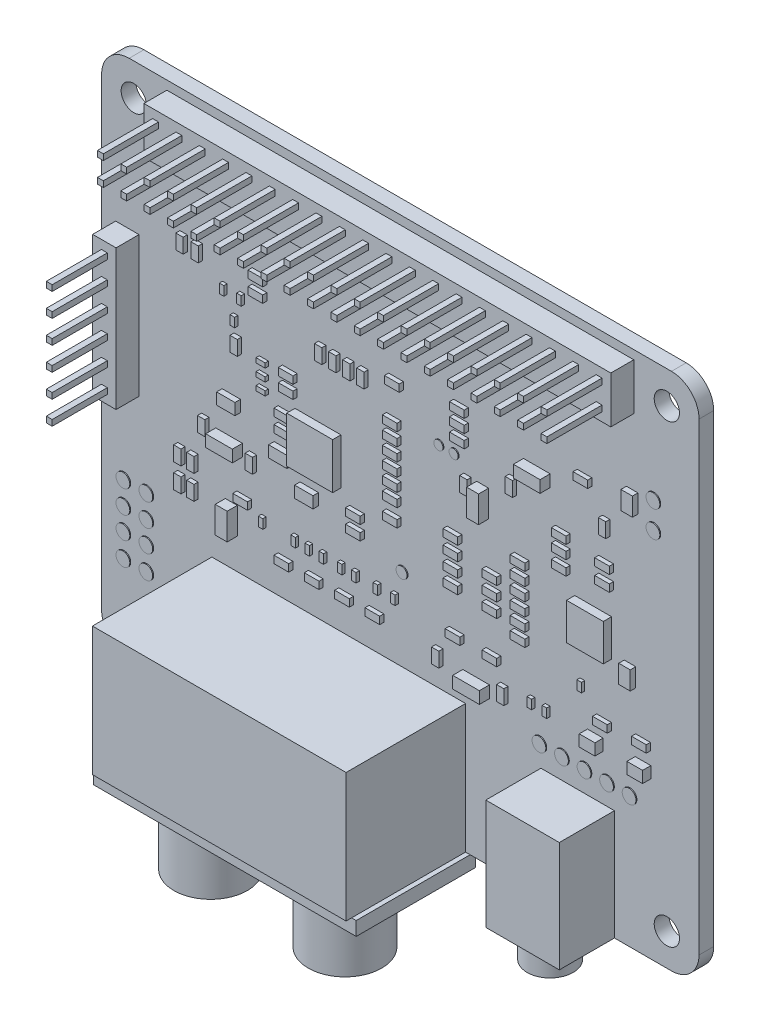
from build123d import *

# Parameters (mm, degrees)
PCB_DEPTH              = 1.6
SKETCH2_W              = 50.8
SKETCH2_H              = 5.08
SKETCH2_W_2            = 2.54
SKETCH2_H_2            = 15.24
HEADER_BLOCKS_DEPTH    = 2.5
SKETCH3_W              = 0.64
SKETCH3_H              = 0.64
HEADER_PINS_DEPTH      = 6
SKETCH4_W              = 1
SKETCH4_H              = 0.5
SKETCH4_W_2            = 0.5
SKETCH4_H_2            = 1
SMD_H0_35_DEPTH        = 0.35
SKETCH5_W              = 0.8
SKETCH5_H              = 1.6
SKETCH5_W_2            = 1.6
SKETCH5_H_2            = 0.8
SMD_H0_45_DEPTH        = 0.45
SKETCH6_W              = 2
SKETCH6_H              = 1.25
SKETCH6_W_2            = 1.25
SKETCH6_H_2            = 2
SMD_H0_6_DEPTH         = 0.6
SKETCH7_W              = 5
SKETCH7_H              = 5
SKETCH7_W_2            = 4
SKETCH7_H_2            = 4
SKETCH7_W_3            = 1.7
SKETCH7_H_3            = 1.25
SMD_H0_9_DEPTH         = 0.9
SKETCH8_W              = 2.9
SKETCH8_H              = 1.3
SKETCH8_W_2            = 1.3
SKETCH8_H_2            = 2.9
SMD_H1_1_DEPTH         = 1.1
SKETCH9_R              = 0.75
SKETCH9_R_2            = 0.6
SKETCH9_R_3            = 0.5
PADS_DEPTH             = 0.1
SKETCH10_W             = 27.6
SKETCH10_H             = 14
RCA_HOUSING_DEPTH      = 13
SKETCH11_W             = 28.6
SKETCH11_H             = 13
RCA_PLATE_DEPTH        = 1.5
SKETCH12_R             = 4
RCA_BARRELS_DEPTH      = 9
SKETCH13_W             = 8
SKETCH13_H             = 12
JACK_BODY_DEPTH        = 6
SKETCH14_R             = 2.5
JACK_NOSE_DEPTH        = 2.5
SKETCH15_R             = 2.5
RCA_BORES_DEPTH        = 9
SKETCH16_R             = 1.75
JACK_BORE_DEPTH        = 2.5
MOUNT_HOLES_DEPTH      = 88.35221806
MOUNT_HOLES_DEPTH_BACK = 88.35221806
SKETCH17_R             = 1.375


with BuildPart() as part:
    # Sketch1 → PCB (new body)
    with BuildSketch(Plane.XY):
        with BuildLine():
            Line((3, 0), (62, 0))
            ThreePointArc((62, 0), (64.121320344, 0.878679656), (65, 3))
            Line((65, 3), (65, 53.5))
            ThreePointArc((65, 53.5), (64.121320344, 55.621320344), (62, 56.5))
            Line((62, 56.5), (3, 56.5))
            ThreePointArc((3, 56.5), (0.878679656, 55.621320344), (0, 53.5))
            Line((0, 53.5), (0, 3))
            ThreePointArc((0, 3), (0.878679656, 0.878679656), (3, 0))
        make_face()
    extrude(amount=PCB_DEPTH)

    # Sketch2 → Header_Blocks (add)
    with BuildSketch(Plane.XY.offset(1.6)):
        with Locations((32.5, 53)):
            Rectangle(SKETCH2_W, SKETCH2_H)
        with Locations((2.8, 32.8)):
            Rectangle(SKETCH2_W_2, SKETCH2_H_2)
    extrude(amount=HEADER_BLOCKS_DEPTH)

    # Sketch3 → Header_Pins (add)
    with BuildSketch(Plane.XY.offset(4.1)):
        with Locations((8.37, 51.73)):
            Rectangle(SKETCH3_W, SKETCH3_H)
        with Locations((8.37, 54.27)):
            Rectangle(SKETCH3_W, SKETCH3_H)
        with Locations((10.91, 51.73)):
            Rectangle(SKETCH3_W, SKETCH3_H)
        with Locations((10.91, 54.27)):
            Rectangle(SKETCH3_W, SKETCH3_H)
        with Locations((13.45, 51.73)):
            Rectangle(SKETCH3_W, SKETCH3_H)
        with Locations((13.45, 54.27)):
            Rectangle(SKETCH3_W, SKETCH3_H)
        with Locations((15.99, 51.73)):
            Rectangle(SKETCH3_W, SKETCH3_H)
        with Locations((15.99, 54.27)):
            Rectangle(SKETCH3_W, SKETCH3_H)
        with Locations((18.53, 51.73)):
            Rectangle(SKETCH3_W, SKETCH3_H)
        with Locations((18.53, 54.27)):
            Rectangle(SKETCH3_W, SKETCH3_H)
        with Locations((21.07, 51.73)):
            Rectangle(SKETCH3_W, SKETCH3_H)
        with Locations((21.07, 54.27)):
            Rectangle(SKETCH3_W, SKETCH3_H)
        with Locations((23.61, 51.73)):
            Rectangle(SKETCH3_W, SKETCH3_H)
        with Locations((23.61, 54.27)):
            Rectangle(SKETCH3_W, SKETCH3_H)
        with Locations((26.15, 51.73)):
            Rectangle(SKETCH3_W, SKETCH3_H)
        with Locations((26.15, 54.27)):
            Rectangle(SKETCH3_W, SKETCH3_H)
        with Locations((28.69, 51.73)):
            Rectangle(SKETCH3_W, SKETCH3_H)
        with Locations((28.69, 54.27)):
            Rectangle(SKETCH3_W, SKETCH3_H)
        with Locations((31.23, 51.73)):
            Rectangle(SKETCH3_W, SKETCH3_H)
        with Locations((31.23, 54.27)):
            Rectangle(SKETCH3_W, SKETCH3_H)
        with Locations((33.77, 51.73)):
            Rectangle(SKETCH3_W, SKETCH3_H)
        with Locations((33.77, 54.27)):
            Rectangle(SKETCH3_W, SKETCH3_H)
        with Locations((36.31, 51.73)):
            Rectangle(SKETCH3_W, SKETCH3_H)
        with Locations((36.31, 54.27)):
            Rectangle(SKETCH3_W, SKETCH3_H)
        with Locations((38.85, 51.73)):
            Rectangle(SKETCH3_W, SKETCH3_H)
        with Locations((38.85, 54.27)):
            Rectangle(SKETCH3_W, SKETCH3_H)
        with Locations((41.39, 51.73)):
            Rectangle(SKETCH3_W, SKETCH3_H)
        with Locations((41.39, 54.27)):
            Rectangle(SKETCH3_W, SKETCH3_H)
        with Locations((43.93, 51.73)):
            Rectangle(SKETCH3_W, SKETCH3_H)
        with Locations((43.93, 54.27)):
            Rectangle(SKETCH3_W, SKETCH3_H)
        with Locations((46.47, 51.73)):
            Rectangle(SKETCH3_W, SKETCH3_H)
        with Locations((46.47, 54.27)):
            Rectangle(SKETCH3_W, SKETCH3_H)
        with Locations((49.01, 51.73)):
            Rectangle(SKETCH3_W, SKETCH3_H)
        with Locations((49.01, 54.27)):
            Rectangle(SKETCH3_W, SKETCH3_H)
        with Locations((51.55, 51.73)):
            Rectangle(SKETCH3_W, SKETCH3_H)
        with Locations((51.55, 54.27)):
            Rectangle(SKETCH3_W, SKETCH3_H)
        with Locations((54.09, 51.73)):
            Rectangle(SKETCH3_W, SKETCH3_H)
        with Locations((54.09, 54.27)):
            Rectangle(SKETCH3_W, SKETCH3_H)
        with Locations((56.63, 51.73)):
            Rectangle(SKETCH3_W, SKETCH3_H)
        with Locations((56.63, 54.27)):
            Rectangle(SKETCH3_W, SKETCH3_H)
        with Locations((2.8, 26.45)):
            Rectangle(SKETCH3_W, SKETCH3_H)
        with Locations((2.8, 28.99)):
            Rectangle(SKETCH3_W, SKETCH3_H)
        with Locations((2.8, 31.53)):
            Rectangle(SKETCH3_W, SKETCH3_H)
        with Locations((2.8, 34.07)):
            Rectangle(SKETCH3_W, SKETCH3_H)
        with Locations((2.8, 36.61)):
            Rectangle(SKETCH3_W, SKETCH3_H)
        with Locations((2.8, 39.15)):
            Rectangle(SKETCH3_W, SKETCH3_H)
    extrude(amount=HEADER_PINS_DEPTH)

    # Sketch4 → SMD_h0_35 (add)
    with BuildSketch(Plane.XY.offset(1.6)):
        with Locations((17.6462, 35.28966)):
            Rectangle(SKETCH4_W, SKETCH4_H)
        with Locations((17.6462, 33.97505)):
            Rectangle(SKETCH4_W, SKETCH4_H)
        with Locations((17.6462, 32.66044)):
            Rectangle(SKETCH4_W, SKETCH4_H)
        with Locations((13.40234, 40.07006)):
            Rectangle(SKETCH4_W_2, SKETCH4_H_2)
        with Locations((15.2885, 40.07006)):
            Rectangle(SKETCH4_W_2, SKETCH4_H_2)
        with Locations((14.58119, 37.67986)):
            Rectangle(SKETCH4_W_2, SKETCH4_H_2)
        with Locations((17.6462, 20.2314)):
            Rectangle(SKETCH4_W_2, SKETCH4_H_2)
        with Locations((21.18275, 20.2314)):
            Rectangle(SKETCH4_W_2, SKETCH4_H_2)
        with Locations((22.715255, 20.2314)):
            Rectangle(SKETCH4_W_2, SKETCH4_H_2)
        with Locations((24.24776, 20.2314)):
            Rectangle(SKETCH4_W_2, SKETCH4_H_2)
        with Locations((26.251805, 20.2314)):
            Rectangle(SKETCH4_W_2, SKETCH4_H_2)
        with Locations((27.78431, 20.2314)):
            Rectangle(SKETCH4_W_2, SKETCH4_H_2)
        with Locations((30.14201, 20.2314)):
            Rectangle(SKETCH4_W_2, SKETCH4_H_2)
        with Locations((32.02817, 20.2314)):
            Rectangle(SKETCH4_W_2, SKETCH4_H_2)
        with Locations((46.88168, 17.8412)):
            Rectangle(SKETCH4_W_2, SKETCH4_H_2)
        with Locations((48.53207, 17.8412)):
            Rectangle(SKETCH4_W_2, SKETCH4_H_2)
        with Locations((52.30439, 22.14356)):
            Rectangle(SKETCH4_W_2, SKETCH4_H_2)
    extrude(amount=SMD_H0_35_DEPTH)

    # Sketch5 → SMD_h0_45 (add)
    with BuildSketch(Plane.XY.offset(1.6)):
        with Locations((24.01199, 39.353)):
            Rectangle(SKETCH5_W, SKETCH5_H)
        with Locations((25.544495, 39.353)):
            Rectangle(SKETCH5_W, SKETCH5_H)
        with Locations((27.077, 39.353)):
            Rectangle(SKETCH5_W, SKETCH5_H)
        with Locations((28.609505, 39.353)):
            Rectangle(SKETCH5_W, SKETCH5_H)
        with Locations((32.02817, 40.5481)):
            Rectangle(SKETCH5_W_2, SKETCH5_H_2)
        with Locations((17.17466, 43.05781)):
            Rectangle(SKETCH5_W_2, SKETCH5_H_2)
        with Locations((17.17466, 41.50418)):
            Rectangle(SKETCH5_W_2, SKETCH5_H_2)
        with Locations((39.10127, 41.62369)):
            Rectangle(SKETCH5_W_2, SKETCH5_H_2)
        with Locations((39.10127, 40.18957)):
            Rectangle(SKETCH5_W_2, SKETCH5_H_2)
        with Locations((39.10127, 38.75545)):
            Rectangle(SKETCH5_W_2, SKETCH5_H_2)
        with Locations((31.7924, 36.72378)):
            Rectangle(SKETCH5_W_2, SKETCH5_H_2)
        with Locations((31.7924, 35.28966)):
            Rectangle(SKETCH5_W_2, SKETCH5_H_2)
        with Locations((31.7924, 33.85554)):
            Rectangle(SKETCH5_W_2, SKETCH5_H_2)
        with Locations((31.7924, 32.42142)):
            Rectangle(SKETCH5_W_2, SKETCH5_H_2)
        with Locations((31.7924, 30.9873)):
            Rectangle(SKETCH5_W_2, SKETCH5_H_2)
        with Locations((31.7924, 29.55318)):
            Rectangle(SKETCH5_W_2, SKETCH5_H_2)
        with Locations((31.7924, 27.64102)):
            Rectangle(SKETCH5_W_2, SKETCH5_H_2)
        with Locations((20.47544, 35.52868)):
            Rectangle(SKETCH5_W_2, SKETCH5_H_2)
        with Locations((20.47544, 34.09456)):
            Rectangle(SKETCH5_W_2, SKETCH5_H_2)
        with Locations((20.0039, 31.46534)):
            Rectangle(SKETCH5_W_2, SKETCH5_H_2)
        with Locations((20.0039, 29.91171)):
            Rectangle(SKETCH5_W_2, SKETCH5_H_2)
        with Locations((27.78431, 25.96788)):
            Rectangle(SKETCH5_W_2, SKETCH5_H_2)
        with Locations((27.78431, 24.41425)):
            Rectangle(SKETCH5_W_2, SKETCH5_H_2)
        with Locations((38.39396, 29.31416)):
            Rectangle(SKETCH5_W_2, SKETCH5_H_2)
        with Locations((38.39396, 27.76053)):
            Rectangle(SKETCH5_W_2, SKETCH5_H_2)
        with Locations((38.39396, 26.2069)):
            Rectangle(SKETCH5_W_2, SKETCH5_H_2)
        with Locations((38.39396, 24.65327)):
            Rectangle(SKETCH5_W_2, SKETCH5_H_2)
        with Locations((42.63782, 27.64102)):
            Rectangle(SKETCH5_W_2, SKETCH5_H_2)
        with Locations((42.63782, 26.08739)):
            Rectangle(SKETCH5_W_2, SKETCH5_H_2)
        with Locations((42.63782, 24.53376)):
            Rectangle(SKETCH5_W_2, SKETCH5_H_2)
        with Locations((45.70283, 30.50926)):
            Rectangle(SKETCH5_W_2, SKETCH5_H_2)
        with Locations((45.70283, 29.07514)):
            Rectangle(SKETCH5_W_2, SKETCH5_H_2)
        with Locations((45.70283, 27.64102)):
            Rectangle(SKETCH5_W_2, SKETCH5_H_2)
        with Locations((45.70283, 26.2069)):
            Rectangle(SKETCH5_W_2, SKETCH5_H_2)
        with Locations((45.70283, 24.77278)):
            Rectangle(SKETCH5_W_2, SKETCH5_H_2)
        with Locations((45.70283, 23.33866)):
            Rectangle(SKETCH5_W_2, SKETCH5_H_2)
        with Locations((50.18246, 35.28966)):
            Rectangle(SKETCH5_W_2, SKETCH5_H_2)
        with Locations((50.18246, 33.85554)):
            Rectangle(SKETCH5_W_2, SKETCH5_H_2)
        with Locations((50.18246, 32.30191)):
            Rectangle(SKETCH5_W_2, SKETCH5_H_2)
        with Locations((54.89786, 38.39692)):
            Rectangle(SKETCH5_W, SKETCH5_H)
        with Locations((54.89786, 34.81162)):
            Rectangle(SKETCH5_W_2, SKETCH5_H_2)
        with Locations((54.89786, 33.13848)):
            Rectangle(SKETCH5_W_2, SKETCH5_H_2)
        with Locations((52.54016, 41.7432)):
            Rectangle(SKETCH5_W_2, SKETCH5_H_2)
        with Locations((39.80858, 34.81162)):
            Rectangle(SKETCH5_W, SKETCH5_H)
        with Locations((44.75975, 37.20182)):
            Rectangle(SKETCH5_W, SKETCH5_H)
        with Locations((20.0039, 17.60218)):
            Rectangle(SKETCH5_W_2, SKETCH5_H_2)
        with Locations((23.30468, 17.60218)):
            Rectangle(SKETCH5_W_2, SKETCH5_H_2)
        with Locations((26.60546, 17.60218)):
            Rectangle(SKETCH5_W_2, SKETCH5_H_2)
        with Locations((29.90624, 17.60218)):
            Rectangle(SKETCH5_W_2, SKETCH5_H_2)
        with Locations((8.68694, 22.14356)):
            Rectangle(SKETCH5_W, SKETCH5_H)
        with Locations((10.10156, 22.14356)):
            Rectangle(SKETCH5_W, SKETCH5_H)
        with Locations((8.68694, 19.51434)):
            Rectangle(SKETCH5_W, SKETCH5_H)
        with Locations((10.10156, 19.51434)):
            Rectangle(SKETCH5_W, SKETCH5_H)
        with Locations((15.52427, 21.18748)):
            Rectangle(SKETCH5_W_2, SKETCH5_H_2)
        with Locations((16.46735, 25.25082)):
            Rectangle(SKETCH5_W, SKETCH5_H)
        with Locations((11.28041, 26.2069)):
            Rectangle(SKETCH5_W, SKETCH5_H)
        with Locations((8.92271, 42.22124)):
            Rectangle(SKETCH5_W, SKETCH5_H)
        with Locations((10.5731, 42.22124)):
            Rectangle(SKETCH5_W, SKETCH5_H)
        with Locations((14.81696, 35.52868)):
            Rectangle(SKETCH5_W, SKETCH5_H)
        with Locations((42.63782, 19.99238)):
            Rectangle(SKETCH5_W_2, SKETCH5_H_2)
        with Locations((38.62973, 19.99238)):
            Rectangle(SKETCH5_W_2, SKETCH5_H_2)
        with Locations((36.74357, 17.12414)):
            Rectangle(SKETCH5_W, SKETCH5_H)
        with Locations((43.81667, 17.12414)):
            Rectangle(SKETCH5_W, SKETCH5_H)
        with Locations((54.66209, 19.75336)):
            Rectangle(SKETCH5_W_2, SKETCH5_H_2)
        with Locations((58.90595, 19.99238)):
            Rectangle(SKETCH5_W_2, SKETCH5_H_2)
    extrude(amount=SMD_H0_45_DEPTH)

    # Sketch6 → SMD_h0_6 (add)
    with BuildSketch(Plane.XY.offset(1.6)):
        with Locations((22.59737, 25.25082)):
            Rectangle(SKETCH6_W, SKETCH6_H)
        with Locations((19.76813, 27.64102)):
            Rectangle(SKETCH6_W, SKETCH6_H)
        with Locations((14.10965, 29.7922)):
            Rectangle(SKETCH6_W, SKETCH6_H)
        with Locations((57.7271, 42.22124)):
            Rectangle(SKETCH6_W_2, SKETCH6_H_2)
        with Locations((57.49133, 25.72886)):
            Rectangle(SKETCH6_W_2, SKETCH6_H_2)
    extrude(amount=SMD_H0_6_DEPTH)

    # Sketch7 → SMD_h0_9 (add)
    with BuildSketch(Plane.XY.offset(1.6)):
        with Locations((23.54045, 30.03122)):
            Rectangle(SKETCH7_W, SKETCH7_H)
        with Locations((53.48324, 28.11906)):
            Rectangle(SKETCH7_W_2, SKETCH7_H_2)
        with Locations((53.71901, 17.60218)):
            Rectangle(SKETCH7_W_3, SKETCH7_H_3)
        with Locations((58.90595, 17.60218)):
            Rectangle(SKETCH7_W_3, SKETCH7_H_3)
    extrude(amount=SMD_H0_9_DEPTH)

    # Sketch8 → SMD_h1_1 (add)
    with BuildSketch(Plane.XY.offset(1.6)):
        with Locations((47.35322, 39.59202)):
            Rectangle(SKETCH8_W, SKETCH8_H)
        with Locations((41.45897, 34.09456)):
            Rectangle(SKETCH8_W_2, SKETCH8_H_2)
        with Locations((14.10965, 18.79728)):
            Rectangle(SKETCH8_W_2, SKETCH8_H_2)
        with Locations((13.87388, 25.72886)):
            Rectangle(SKETCH8_W, SKETCH8_H)
        with Locations((40.75166, 16.40708)):
            Rectangle(SKETCH8_W, SKETCH8_H)
    extrude(amount=SMD_H1_1_DEPTH)

    # Sketch9 → Pads (add)
    with BuildSketch(Plane.XY.offset(1.6)):
        with Locations((2.415458, 16.502688)):
            Circle(SKETCH9_R)
        with Locations((2.415458, 14.01688)):
            Circle(SKETCH9_R)
        with Locations((2.415458, 11.62668)):
            Circle(SKETCH9_R)
        with Locations((2.415458, 9.093068)):
            Circle(SKETCH9_R)
        with Locations((4.91462, 16.502688)):
            Circle(SKETCH9_R)
        with Locations((4.91462, 14.01688)):
            Circle(SKETCH9_R)
        with Locations((4.91462, 11.62668)):
            Circle(SKETCH9_R)
        with Locations((4.91462, 9.093068)):
            Circle(SKETCH9_R)
        with Locations((47.683298, 14.2559)):
            Circle(SKETCH9_R)
        with Locations((50.135306, 14.2559)):
            Circle(SKETCH9_R)
        with Locations((52.587314, 14.2559)):
            Circle(SKETCH9_R)
        with Locations((55.039322, 14.2559)):
            Circle(SKETCH9_R)
        with Locations((57.49133, 14.2559)):
            Circle(SKETCH9_R)
        with Locations((60.0848, 43.41634)):
            Circle(SKETCH9_R)
        with Locations((60.0848, 40.5481)):
            Circle(SKETCH9_R)
        with Locations((32.73548, 22.956228)):
            Circle(SKETCH9_R_2)
        with Locations((36.74357, 36.9628)):
            Circle(SKETCH9_R_3)
        with Locations((38.39396, 36.9628)):
            Circle(SKETCH9_R_3)
    extrude(amount=PADS_DEPTH)

    # Sketch10 → RCA_Housing (add)
    with BuildSketch(Plane.XY.offset(1.6)):
        with Locations((25.8, 7)):
            Rectangle(SKETCH10_W, SKETCH10_H)
    extrude(amount=RCA_HOUSING_DEPTH)

    # Sketch11 → RCA_Plate (add)
    with BuildSketch(Plane(origin=(0, 0, 0), x_dir=(1, 0, 0), z_dir=(0, 1, 0))):
        with Locations((25.8, -7.5)):
            Rectangle(SKETCH11_W, SKETCH11_H)
    extrude(amount=-RCA_PLATE_DEPTH)

    # Sketch12 → RCA_Barrels (add)
    with BuildSketch(Plane(origin=(0, 0, 0), x_dir=(1, 0, 0), z_dir=(0, 1, 0))):
        with Locations((18.36, -8.1)):
            Circle(SKETCH12_R)
        with Locations((32.98, -8.1)):
            Circle(SKETCH12_R)
    extrude(amount=-RCA_BARRELS_DEPTH)

    # Sketch13 → Jack_Body (add)
    with BuildSketch(Plane.XY.offset(1.6)):
        with Locations((51.8, 6)):
            Rectangle(SKETCH13_W, SKETCH13_H)
    extrude(amount=JACK_BODY_DEPTH)

    # Sketch14 → Jack_Nose (add)
    with BuildSketch(Plane(origin=(0, 0, 0), x_dir=(1, 0, 0), z_dir=(0, 1, 0))):
        with Locations((51.8, -4.6)):
            Circle(SKETCH14_R)
    extrude(amount=-JACK_NOSE_DEPTH)

    # Sketch15 → RCA_Bores (cut)
    with BuildSketch(Plane(origin=(0, 0, 0), x_dir=(1, 0, 0), z_dir=(0, 1, 0))):
        with Locations((18.36, -8.1)):
            Circle(SKETCH15_R)
        with Locations((32.98, -8.1)):
            Circle(SKETCH15_R)
    extrude(amount=RCA_BORES_DEPTH, mode=Mode.SUBTRACT)

    # Sketch16 → Jack_Bore (cut)
    with BuildSketch(Plane(origin=(0, 0, 0), x_dir=(1, 0, 0), z_dir=(0, 1, 0))):
        with Locations((51.8, -4.6)):
            Circle(SKETCH16_R)
    extrude(amount=JACK_BORE_DEPTH, mode=Mode.SUBTRACT)

    # Sketch17 → Mount_Holes (cut, two sides: drawn at the far end of the back side and taken through both)
    with BuildSketch(Plane.XY.offset(-MOUNT_HOLES_DEPTH_BACK)):
        with Locations((3.5, 3.5)):
            Circle(SKETCH17_R)
        with Locations((3.5, 53)):
            Circle(SKETCH17_R)
        with Locations((61.5, 3.5)):
            Circle(SKETCH17_R)
        with Locations((61.5, 53)):
            Circle(SKETCH17_R)
    extrude(amount=MOUNT_HOLES_DEPTH + MOUNT_HOLES_DEPTH_BACK, mode=Mode.SUBTRACT)


solid = part.part
